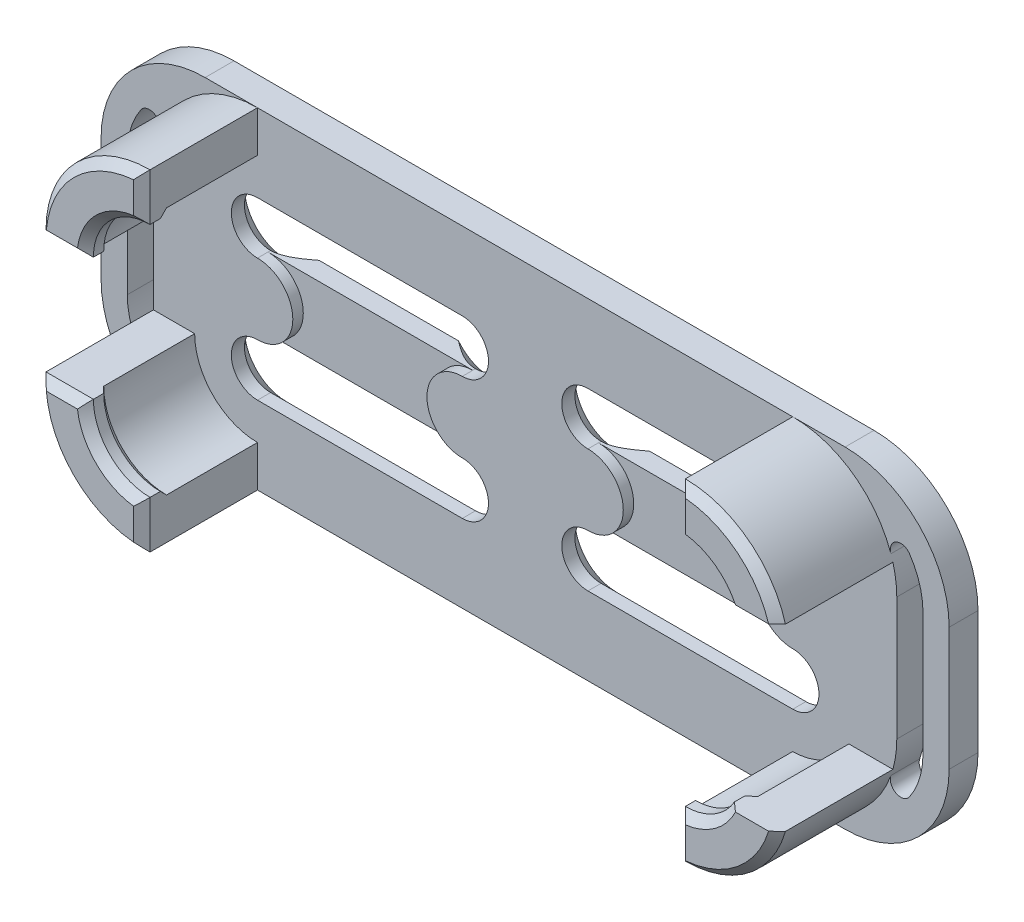
from build123d import *

# Parameters (mm, degrees)
BOSS_EXTRUDE1_DEPTH   = 12.033125032
BOSS_EXTRUDE1_2_DEPTH = 12.033125032
BOSS_EXTRUDE1_3_DEPTH = 12.033125032
BOSS_EXTRUDE1_4_DEPTH = 12.033125032
BOSS_EXTRUDE2_START   = 3.5
BOSS_EXTRUDE2_DEPTH   = 3.5
BOSS_EXTRUDE3_DEPTH   = 2
CUT_EXTRUDE1_DEPTH    = 1.27
CHAMFER1_SIZE         = 1
CUT_EXTRUDE2_DEPTH    = 52.31068182
BOSS_EXTRUDE4_DEPTH   = 3.5
FILLET1_R             = 1.27
CHAMFER2_SIZE         = 1.905


with BuildPart() as part:
    # Sketch2 → Boss-Extrude1 (new body)
    with BuildSketch(Plane.XY):
        with BuildLine():
            Line((-32.464375, 20.08125), (-32.464375, 15.08125))
            ThreePointArc((-32.464375, 15.08125), (-37.852528673, 12.849403673), (-40.084375, 7.46125))
            Line((-40.084375, 7.46125), (-45.084375, 7.46125))
            ThreePointArc((-45.084375, 7.46125), (-41.388062579, 16.384937579), (-32.464375, 20.08125))
        make_face()
    extrude(amount=BOSS_EXTRUDE1_DEPTH)



with BuildPart() as body_2:
    # Sketch2 → Boss-Extrude1 2 (new body)
    with BuildSketch(Plane.XY):
        with BuildLine():
            Line((32.464375, 20.08125), (32.464375, 15.08125))
            ThreePointArc((32.464375, 15.08125), (37.852528673, 12.849403673), (40.084375, 7.46125))
            Line((40.084375, 7.46125), (45.084375, 7.46125))
            ThreePointArc((45.084375, 7.46125), (41.388062579, 16.384937579), (32.464375, 20.08125))
        make_face()
    extrude(amount=BOSS_EXTRUDE1_2_DEPTH)


with BuildPart() as body_3:
    # Sketch2 → Boss-Extrude1 3 (new body)
    with BuildSketch(Plane.XY):
        with BuildLine():
            Line((-40.084375, -7.46125), (-45.084375, -7.46125))
            ThreePointArc((-45.084375, -7.46125), (-41.388062579, -16.384937579), (-32.464375, -20.08125))
            Line((-32.464375, -20.08125), (-32.464375, -15.08125))
            ThreePointArc((-32.464375, -15.08125), (-37.852528673, -12.849403673), (-40.084375, -7.46125))
        make_face()
    extrude(amount=BOSS_EXTRUDE1_3_DEPTH)


with BuildPart() as body_4:
    # Sketch2 → Boss-Extrude1 4 (new body)
    with BuildSketch(Plane.XY):
        with BuildLine():
            Line((32.464375, -20.08125), (32.464375, -15.08125))
            ThreePointArc((32.464375, -15.08125), (37.852528673, -12.849403673), (40.084375, -7.46125))
            Line((40.084375, -7.46125), (45.084375, -7.46125))
            ThreePointArc((45.084375, -7.46125), (41.388062579, -16.384937579), (32.464375, -20.08125))
        make_face()
    extrude(amount=BOSS_EXTRUDE1_4_DEPTH)


with BuildPart() as part_1:
    add(part.part)

    add(body_2.part)  # Boss-Extrude2 merges body 2

    add(body_3.part)  # Boss-Extrude2 merges body 3

    add(body_4.part)  # Boss-Extrude2 merges body 4
    # Sketch3 → Boss-Extrude2 (add)
    with BuildSketch(Plane(origin=(0, 0, 0), x_dir=(-1, 0, 0), z_dir=(0, 0, -1)).offset(BOSS_EXTRUDE2_START)):
        with BuildLine():
            Line((-45.084375, 7.46125), (-45.084375, -7.46125))
            ThreePointArc((-45.084375, -7.46125), (-41.388062579, -16.384937579), (-32.464375, -20.08125))
            Line((-32.464375, -20.08125), (32.464375, -20.08125))
            ThreePointArc((32.464375, -20.08125), (41.388062579, -16.384937579), (45.084375, -7.46125))
            Line((45.084375, -7.46125), (45.084375, 7.46125))
            ThreePointArc((45.084375, 7.46125), (41.388062579, 16.384937579), (32.464375, 20.08125))
            Line((32.464375, 20.08125), (-32.464375, 20.08125))
            ThreePointArc((-32.464375, 20.08125), (-41.388062579, 16.384937579), (-45.084375, 7.46125))
        make_face()
        with BuildLine():
            Line((7.62, 10.63625), (32.464375, 10.63625))
            ThreePointArc((32.464375, 10.63625), (35.639375, 7.46125), (32.464375, 4.28625))
            Line((32.464375, 4.28625), (7.62, 4.28625))
            ThreePointArc((7.62, 4.28625), (4.445, 7.46125), (7.62, 10.63625))
        make_face(mode=Mode.SUBTRACT)
        with BuildLine():
            Line((7.62, -10.63625), (32.464375, -10.63625))
            ThreePointArc((32.464375, -10.63625), (35.639375, -7.46125), (32.464375, -4.28625))
            Line((32.464375, -4.28625), (7.62, -4.28625))
            ThreePointArc((7.62, -4.28625), (4.445, -7.46125), (7.62, -10.63625))
        make_face(mode=Mode.SUBTRACT)
        with BuildLine():
            Line((-7.62, -10.63625), (-32.464375, -10.63625))
            ThreePointArc((-32.464375, -10.63625), (-35.639375, -7.46125), (-32.464375, -4.28625))
            Line((-32.464375, -4.28625), (-7.62, -4.28625))
            ThreePointArc((-7.62, -4.28625), (-4.445, -7.46125), (-7.62, -10.63625))
        make_face(mode=Mode.SUBTRACT)
        with BuildLine():
            Line((-7.62, 10.63625), (-32.464375, 10.63625))
            ThreePointArc((-32.464375, 10.63625), (-35.639375, 7.46125), (-32.464375, 4.28625))
            Line((-32.464375, 4.28625), (-7.62, 4.28625))
            ThreePointArc((-7.62, 4.28625), (-4.445, 7.46125), (-7.62, 10.63625))
        make_face(mode=Mode.SUBTRACT)
    extrude(amount=-BOSS_EXTRUDE2_DEPTH)

    # Sketch5 → Boss-Extrude3 (add)
    with BuildSketch(Plane.XY.offset(12.033125032)):
        with BuildLine():
            Line((-32.464375, 14.33125), (-32.464375, 20.08125))
            ThreePointArc((-32.464375, 20.08125), (-41.388062579, 16.384937579), (-45.084375, 7.46125))
            Line((-45.084375, 7.46125), (-39.334375, 7.46125))
            ThreePointArc((-39.334375, 7.46125), (-37.322198587, 12.319073587), (-32.464375, 14.33125))
        make_face()
        with BuildLine():
            Line((32.464375, 14.33125), (32.464375, 20.08125))
            ThreePointArc((32.464375, 20.08125), (41.388062579, 16.384937579), (45.084375, 7.46125))
            Line((45.084375, 7.46125), (39.334375, 7.46125))
            ThreePointArc((39.334375, 7.46125), (37.322198587, 12.319073587), (32.464375, 14.33125))
        make_face()
        with BuildLine():
            Line((45.084375, -7.46125), (39.334375, -7.46125))
            ThreePointArc((39.334375, -7.46125), (37.322198587, -12.319073587), (32.464375, -14.33125))
            Line((32.464375, -14.33125), (32.464375, -20.08125))
            ThreePointArc((32.464375, -20.08125), (41.388062579, -16.384937579), (45.084375, -7.46125))
        make_face()
        with BuildLine():
            Line((-45.084375, -7.46125), (-39.334375, -7.46125))
            ThreePointArc((-39.334375, -7.46125), (-37.322198587, -12.319073587), (-32.464375, -14.33125))
            Line((-32.464375, -14.33125), (-32.464375, -20.08125))
            ThreePointArc((-32.464375, -20.08125), (-41.388062579, -16.384937579), (-45.084375, -7.46125))
        make_face()
    extrude(amount=BOSS_EXTRUDE3_DEPTH)

    # Sketch4 → Cut-Extrude1 (cut)
    with BuildSketch(Plane.XY):
        with BuildLine():
            Line((-32.464375, -4.28625), (-7.62, -4.28625))
            ThreePointArc((-7.62, -4.28625), (-11.90625, 0), (-7.62, 4.28625))
            Line((-7.62, 4.28625), (-32.464375, 4.28625))
            ThreePointArc((-32.464375, 4.28625), (-28.178125, 0), (-32.464375, -4.28625))
        make_face()
    cut_extrude1 = extrude(amount=-CUT_EXTRUDE1_DEPTH, mode=Mode.SUBTRACT)

    # Chamfer1
    # the kernel refuses this chamfer: 1 mm, written as the material it adds along each edge
    with BuildSketch(Plane(origin=(-32.464375, -7.46125, 12.033125032), x_dir=(0, -1, 0), z_dir=(1, 0, 0))) as chamfer1_piece_1_section:
        Polygon((7.62, CHAMFER1_SIZE), (7.62 - CHAMFER1_SIZE, 0), (7.62, 0), align=None)
    chamfer1_piece_1 = revolve(axis=Axis((-32.464375, -7.46125, 12.033125032), (0, 0, -1)), revolution_arc=90, mode=Mode.PRIVATE)
    chamfer1_piece_1 = chamfer1_piece_1 - Plane(origin=(-32.464375, -7.46125, 11.406730953), x_dir=(-1, 0, 0), z_dir=(0, 0, -1)) * Cylinder(6.87, 31, mode=Mode.PRIVATE)
    add(chamfer1_piece_1)
    with BuildSketch(Plane(origin=(32.464375, -7.46125, 12.033125032), x_dir=(0, -1, 0), z_dir=(-1, 0, 0))) as chamfer1_piece_2_section:
        Polygon((7.62, -CHAMFER1_SIZE), (7.62 - CHAMFER1_SIZE, 0), (7.62, 0), align=None)
    chamfer1_piece_2 = revolve(axis=Axis((32.464375, -7.46125, 12.033125032), (0, 0, 1)), revolution_arc=90, mode=Mode.PRIVATE)
    chamfer1_piece_2 = chamfer1_piece_2 - Plane(origin=(32.464375, -7.46125, 11.406730953), x_dir=(1, 0, 0), z_dir=(0, 0, -1)) * Cylinder(6.87, 31, mode=Mode.PRIVATE)
    add(chamfer1_piece_2)
    with BuildSketch(Plane(origin=(32.464375, 7.46125, 12.033125032), x_dir=(0, 1, 0), z_dir=(-1, 0, 0))) as chamfer1_piece_3_section:
        Polygon((7.62, CHAMFER1_SIZE), (7.62 - CHAMFER1_SIZE, 0), (7.62, 0), align=None)
    chamfer1_piece_3 = revolve(axis=Axis((32.464375, 7.46125, 12.033125032), (0, 0, -1)), revolution_arc=90, mode=Mode.PRIVATE)
    chamfer1_piece_3 = chamfer1_piece_3 - Plane(origin=(32.464375, 7.46125, 11.406730953), x_dir=(1, 0, 0), z_dir=(0, 0, -1)) * Cylinder(6.87, 31, mode=Mode.PRIVATE)
    add(chamfer1_piece_3)
    with BuildSketch(Plane(origin=(-32.464375, 7.46125, 12.033125032), x_dir=(0, 1, 0), z_dir=(1, 0, 0))) as chamfer1_piece_4_section:
        Polygon((7.62 - CHAMFER1_SIZE, 0), (7.62, -CHAMFER1_SIZE), (7.62, 0), align=None)
    chamfer1_piece_4 = revolve(axis=Axis((-32.464375, 7.46125, 12.033125032), (0, 0, 1)), revolution_arc=90, mode=Mode.PRIVATE)
    chamfer1_piece_4 = chamfer1_piece_4 - Plane(origin=(-32.464375, 7.46125, 11.406730953), x_dir=(-1, 0, 0), z_dir=(0, 0, -1)) * Cylinder(6.87, 31, mode=Mode.PRIVATE)
    add(chamfer1_piece_4)
    # the kernel refuses this chamfer: 1 mm, written as the material it takes off along each edge
    with BuildSketch(Plane(origin=(47.656057988, 7.46125, 14.033125032), x_dir=(0, 0.9996219169112968, 0.027495876610585647), z_dir=(-1, 0, 0)), Plane(origin=(32.464375, 11.759567012, 14.033125032), x_dir=(0.9996219169112968, -1.2352592896833197e-15, 0.02749587661058555), z_dir=(0, 1, 0)), Plane(origin=(-32.464375, 11.759567012, 14.033125032), x_dir=(0.0274958766105891, 0, -0.9996219169112968), z_dir=(0, 1, 0)), Plane(origin=(-47.656057988, 7.46125, 14.033125032), x_dir=(0, -0.02749587661058651, -0.9996219169112968), z_dir=(1, 0, 0)), Plane(origin=(-47.656057988, -7.46125, 14.033125032), x_dir=(0, -0.9996219169112968, 0.027495876610585623), z_dir=(1, 0, 0)), Plane(origin=(-32.464375, -11.759567012, 14.033125032), x_dir=(-0.9996219169112968, 1.2352592896833197e-15, 0.02749587661058555), z_dir=(0, -1, 0))) as chamfer1_2_piece_1:
        Polygon((CHAMFER1_SIZE * 0.999621916911, CHAMFER1_SIZE * 0.0274958766106), (-CHAMFER1_SIZE * 0.0274958766106, CHAMFER1_SIZE * 0.999621916911), (0, 0), align=None)
    extrude(amount=10.893365976, mode=Mode.SUBTRACT)
    with BuildSketch(Plane(origin=(32.464375, 7.46125, 14.033125032), x_dir=(0.9306959103421094, -0.36579382508794805, 0), z_dir=(-0.36579382508794805, -0.9306959103421094, 0))) as chamfer1_2_piece_2:
        Polygon((6.87 + CHAMFER1_SIZE, 0), (6.87, -CHAMFER1_SIZE), (6.87, 0), align=None)
    revolve(axis=Axis((32.464375, 7.46125, 14.033125032), (0, 0, 1)), revolution_arc=132.912888437, mode=Mode.SUBTRACT)
    with BuildSketch(Plane(origin=(32.464375, 7.46125, 14.033125032), x_dir=(-0.2024511198117661, 0.9792923690537785, 0), z_dir=(-0.9792923690537785, -0.2024511198117661, 0))) as chamfer1_2_piece_3:
        Polygon((12.62, CHAMFER1_SIZE), (12.62 - CHAMFER1_SIZE, 0), (12.62, 0), align=None)
    revolve(axis=Axis((32.464375, 7.46125, 14.033125032), (0, 0, -1)), revolution_arc=113.360661138, mode=Mode.SUBTRACT)
    with BuildSketch(Plane(origin=(47.656057988, -7.46125, 14.033125032), x_dir=(0, -0.9996219169112968, 0.027495876610585647), z_dir=(-1, 0, 0)), Plane(origin=(32.464375, -11.759567012, 14.033125032), x_dir=(0.9996219169112968, 1.2352592896833197e-15, 0.02749587661058555), z_dir=(0, -1, 0))) as chamfer1_2_piece_4:
        Polygon((CHAMFER1_SIZE * 0.999621916911, -CHAMFER1_SIZE * 0.0274958766106), (-CHAMFER1_SIZE * 0.0274958766106, -CHAMFER1_SIZE * 0.999621916911), (0, 0), align=None)
    extrude(amount=10.893365976, mode=Mode.SUBTRACT)
    with BuildSketch(Plane(origin=(32.464375, -7.46125, 14.033125032), x_dir=(-0.2024511198117661, -0.9792923690537785, 0), z_dir=(-0.9792923690537785, 0.2024511198117661, 0))) as chamfer1_2_piece_5:
        Polygon((12.62, -CHAMFER1_SIZE), (12.62 - CHAMFER1_SIZE, 0), (12.62, 0), align=None)
    revolve(axis=Axis((32.464375, -7.46125, 14.033125032), (0, 0, 1)), revolution_arc=113.360661138, mode=Mode.SUBTRACT)
    with BuildSketch(Plane(origin=(32.464375, -7.46125, 14.033125032), x_dir=(0.9306959103421094, 0.36579382508794805, 0), z_dir=(-0.36579382508794805, 0.9306959103421094, 0))) as chamfer1_2_piece_6:
        Polygon((6.87 + CHAMFER1_SIZE, 0), (6.87, CHAMFER1_SIZE), (6.87, 0), align=None)
    revolve(axis=Axis((32.464375, -7.46125, 14.033125032), (0, 0, -1)), revolution_arc=132.912888437, mode=Mode.SUBTRACT)
    with BuildSketch(Plane(origin=(-32.464375, 7.46125, 14.033125032), x_dir=(-0.9306959103421083, -0.3657938250879505, 0), z_dir=(0.3657938250879505, -0.9306959103421083, 0))) as chamfer1_2_piece_7:
        Polygon((6.87, CHAMFER1_SIZE), (6.87 + CHAMFER1_SIZE, 0), (6.87, 0), align=None)
    revolve(axis=Axis((-32.464375, 7.46125, 14.033125032), (0, 0, -1)), revolution_arc=132.912888437, mode=Mode.SUBTRACT)
    with BuildSketch(Plane(origin=(-32.464375, 7.46125, 14.033125032), x_dir=(0.20245111981176475, 0.9792923690537788, 0), z_dir=(0.9792923690537788, -0.20245111981176475, 0))) as chamfer1_2_piece_8:
        Polygon((12.62 - CHAMFER1_SIZE, 0), (12.62, -CHAMFER1_SIZE), (12.62, 0), align=None)
    revolve(axis=Axis((-32.464375, 7.46125, 14.033125032), (0, 0, 1)), revolution_arc=113.360661138, mode=Mode.SUBTRACT)
    with BuildSketch(Plane(origin=(-32.464375, -7.46125, 14.033125032), x_dir=(-0.9306959103421094, 0.3657938250879479, 0), z_dir=(0.3657938250879479, 0.9306959103421094, 0))) as chamfer1_2_piece_9:
        Polygon((6.87 + CHAMFER1_SIZE, 0), (6.87, -CHAMFER1_SIZE), (6.87, 0), align=None)
    revolve(axis=Axis((-32.464375, -7.46125, 14.033125032), (0, 0, 1)), revolution_arc=132.912888437, mode=Mode.SUBTRACT)
    with BuildSketch(Plane(origin=(-32.464375, -7.46125, 14.033125032), x_dir=(0.20245111981176475, -0.9792923690537788, 0), z_dir=(0.9792923690537788, 0.20245111981176475, 0))) as chamfer1_2_piece_10:
        Polygon((12.62, CHAMFER1_SIZE), (12.62 - CHAMFER1_SIZE, 0), (12.62, 0), align=None)
    revolve(axis=Axis((-32.464375, -7.46125, 14.033125032), (0, 0, -1)), revolution_arc=113.360661138, mode=Mode.SUBTRACT)

    # Sketch7 → Cut-Extrude2 (cut, through all)
    with BuildSketch(Plane.XY):
        with BuildLine():
            ThreePointArc((40.084375, -7.46125), (39.878618249, -9.220055574), (39.272459764, -10.883877915))
            Line((39.272459764, -10.883877915), (44.611391842, -10.883877915))
            ThreePointArc((44.611391842, -10.883877915), (44.965569994, -9.188827416), (45.084375, -7.46125))
            Line((45.084375, -7.46125), (40.084375, -7.46125))
        make_face()
        with BuildLine():
            ThreePointArc((45.084375, 7.46125), (44.965569994, 9.188827416), (44.611391842, 10.883877915))
            Line((44.611391842, 10.883877915), (39.272459764, 10.883877915))
            ThreePointArc((39.272459764, 10.883877915), (39.878618249, 9.220055574), (40.084375, 7.46125))
            Line((40.084375, 7.46125), (45.084375, 7.46125))
        make_face()
        with BuildLine():
            ThreePointArc((40.084375, 7.46125), (39.878618249, 9.220055574), (39.272459764, 10.883877915))
            Line((39.272459764, 10.883877915), (38.42109542, 10.883877915))
            ThreePointArc((38.42109542, 10.883877915), (39.102129488, 9.232440379), (39.334375, 7.46125))
            Line((39.334375, 7.46125), (40.084375, 7.46125))
        make_face()
        with BuildLine():
            ThreePointArc((39.334375, -7.46125), (39.102129488, -9.232440379), (38.42109542, -10.883877915))
            Line((38.42109542, -10.883877915), (39.272459764, -10.883877915))
            ThreePointArc((39.272459764, -10.883877915), (39.878618249, -9.220055574), (40.084375, -7.46125))
            Line((40.084375, -7.46125), (39.334375, -7.46125))
        make_face()
    extrude(amount=CUT_EXTRUDE2_DEPTH, mode=Mode.SUBTRACT)

    # Sketch8 → Boss-Extrude4 (add)
    with BuildSketch(Plane(origin=(0, 0, -3.5), x_dir=(-1, 0, 0), z_dir=(0, 0, -1))):
        with BuildLine():
            ThreePointArc((-38.814375, 20.08125), (-47.738062579, 16.384937579), (-51.434375, 7.46125))
            Line((-51.434375, 7.46125), (-51.434375, -7.46125))
            ThreePointArc((-51.434375, -7.46125), (-47.738062579, -16.384937579), (-38.814375, -20.08125))
            Line((-38.814375, -20.08125), (-32.464375, -20.08125))
            ThreePointArc((-32.464375, -20.08125), (-37.14350905, -19.18174933), (-41.155625, -16.61147259))
            ThreePointArc((-41.155625, -16.61147259), (-46.274975889, -13.253266866), (-48.259375, -7.46125))
            Line((-48.259375, -7.46125), (-48.259375, 7.46125))
            ThreePointArc((-48.259375, 7.46125), (-46.274975889, 13.253266866), (-41.155625, 16.61147259))
            ThreePointArc((-41.155625, 16.61147259), (-37.14350905, 19.18174933), (-32.464375, 20.08125))
            Line((-32.464375, 20.08125), (-38.814375, 20.08125))
        make_face()
        with BuildLine():
            ThreePointArc((48.259375, -7.46125), (46.274975889, -13.253266866), (41.155625, -16.61147259))
            ThreePointArc((41.155625, -16.61147259), (37.14350905, -19.18174933), (32.464375, -20.08125))
            Line((32.464375, -20.08125), (38.814375, -20.08125))
            ThreePointArc((38.814375, -20.08125), (47.738062579, -16.384937579), (51.434375, -7.46125))
            Line((51.434375, -7.46125), (51.434375, 7.46125))
            ThreePointArc((51.434375, 7.46125), (47.738062579, 16.384937579), (38.814375, 20.08125))
            Line((38.814375, 20.08125), (32.464375, 20.08125))
            ThreePointArc((32.464375, 20.08125), (37.14350905, 19.18174933), (41.155625, 16.61147259))
            ThreePointArc((41.155625, 16.61147259), (46.274975889, 13.253266866), (48.259375, 7.46125))
            Line((48.259375, 7.46125), (48.259375, -7.46125))
        make_face()
    extrude(amount=-BOSS_EXTRUDE4_DEPTH)

    # Fillet1
    fillet1_edges = [part_1.edges().sort_by_distance(p)[0] for p in [
        (41.155625, -16.61147259, -1.75),
        (41.155625, 16.61147259, -1.75),
        (-41.155625, -16.61147259, -1.75),
        (-41.155625, 16.61147259, -1.75),
    ]]
    fillet(fillet1_edges, radius=FILLET1_R)

    # Mirror3: Cut-Extrude1 across plane
    add(cut_extrude1.mirror(Plane(origin=(0, 0, 0), x_dir=(0, 0, 1), z_dir=(1, 0, 0))), mode=Mode.SUBTRACT)

    # Chamfer2
    # the kernel refuses this chamfer: 1.905 mm, written as the material it takes off along each edge
    with BuildSketch(Plane(origin=(-7.62, 7.46125, -3.5), x_dir=(-0.999679843484402, -0.025302381923478088, 0), z_dir=(-0.025302381923478088, 0.999679843484402, 0))) as chamfer2_piece_1:
        Polygon((3.175 + CHAMFER2_SIZE, 0), (3.175, CHAMFER2_SIZE), (3.175, 0), align=None)
    revolve(axis=Axis((-7.62, 7.46125, -3.5), (0, 0, 1)), revolution_arc=268.550125572, mode=Mode.SUBTRACT)
    with BuildSketch(Plane(origin=(-32.464375, 7.46125, -3.5), x_dir=(0, 1, 0), z_dir=(1, 0, 0))) as chamfer2_piece_2:
        Polygon((3.175 + CHAMFER2_SIZE, 0), (3.175, CHAMFER2_SIZE), (3.175, 0), align=None)
    revolve(axis=Axis((-32.464375, 7.46125, -3.5), (0, 0, 1)), revolution_arc=268.550125572, mode=Mode.SUBTRACT)
    with BuildSketch(Plane(origin=(-7.62, 10.63625, -3.5), x_dir=(0, 0.9996219169112968, -0.027495876610586386), z_dir=(-1, 0, 0)), Plane(origin=(7.62, -10.63625, -3.5), x_dir=(0, -0.9996219169112968, -0.027495876610586386), z_dir=(1, 0, 0))) as chamfer2_piece_3:
        Polygon((CHAMFER2_SIZE * 0.999621916911, -CHAMFER2_SIZE * 0.0274958766106), (-CHAMFER2_SIZE * 0.0274958766106, -CHAMFER2_SIZE * 0.999621916911), (0, 0), align=None)
    extrude(amount=24.844375, mode=Mode.SUBTRACT)
    with BuildSketch(Plane(origin=(-7.62, -7.46125, -3.5), x_dir=(-0.9996798434844021, 0.02530238192347752, 0), z_dir=(-0.02530238192347752, -0.9996798434844021, 0))) as chamfer2_piece_4:
        Polygon((3.175 + CHAMFER2_SIZE, 0), (3.175, -CHAMFER2_SIZE), (3.175, 0), align=None)
    revolve(axis=Axis((-7.62, -7.46125, -3.5), (0, 0, -1)), revolution_arc=268.550125572, mode=Mode.SUBTRACT)
    with BuildSketch(Plane(origin=(-7.62, -10.63625, -3.5), x_dir=(0, -0.9996219169112968, -0.027495876610586386), z_dir=(-1, 0, 0)), Plane(origin=(7.62, 10.63625, -3.5), x_dir=(0, 0.9996219169112968, -0.027495876610586386), z_dir=(1, 0, 0))) as chamfer2_piece_5:
        Polygon((CHAMFER2_SIZE * 0.999621916911, CHAMFER2_SIZE * 0.0274958766106), (-CHAMFER2_SIZE * 0.0274958766106, CHAMFER2_SIZE * 0.999621916911), (0, 0), align=None)
    extrude(amount=24.844375, mode=Mode.SUBTRACT)
    with BuildSketch(Plane(origin=(-32.464375, -7.46125, -3.5), x_dir=(0, -1, 0), z_dir=(1, 0, 0))) as chamfer2_piece_6:
        Polygon((3.175 + CHAMFER2_SIZE, 0), (3.175, -CHAMFER2_SIZE), (3.175, 0), align=None)
    revolve(axis=Axis((-32.464375, -7.46125, -3.5), (0, 0, -1)), revolution_arc=268.550125572, mode=Mode.SUBTRACT)
    with BuildSketch(Plane(origin=(7.62, -7.46125, -3.5), x_dir=(0.9996798434844021, 0.02530238192347752, 0), z_dir=(0.02530238192347752, -0.9996798434844021, 0))) as chamfer2_piece_7:
        Polygon((3.175 + CHAMFER2_SIZE, 0), (3.175, CHAMFER2_SIZE), (3.175, 0), align=None)
    revolve(axis=Axis((7.62, -7.46125, -3.5), (0, 0, 1)), revolution_arc=268.550125572, mode=Mode.SUBTRACT)
    with BuildSketch(Plane(origin=(32.464375, -7.46125, -3.5), x_dir=(0, -1, 0), z_dir=(-1, 0, 0))) as chamfer2_piece_8:
        Polygon((3.175 + CHAMFER2_SIZE, 0), (3.175, CHAMFER2_SIZE), (3.175, 0), align=None)
    revolve(axis=Axis((32.464375, -7.46125, -3.5), (0, 0, 1)), revolution_arc=268.550125572, mode=Mode.SUBTRACT)
    with BuildSketch(Plane(origin=(7.62, 7.46125, -3.5), x_dir=(0.999679843484402, -0.025302381923478088, 0), z_dir=(0.025302381923478088, 0.999679843484402, 0))) as chamfer2_piece_9:
        Polygon((3.175 + CHAMFER2_SIZE, 0), (3.175, -CHAMFER2_SIZE), (3.175, 0), align=None)
    revolve(axis=Axis((7.62, 7.46125, -3.5), (0, 0, -1)), revolution_arc=268.550125572, mode=Mode.SUBTRACT)
    with BuildSketch(Plane(origin=(32.464375, 7.46125, -3.5), x_dir=(0, 1, 0), z_dir=(-1, 0, 0))) as chamfer2_piece_10:
        Polygon((3.175 + CHAMFER2_SIZE, 0), (3.175, -CHAMFER2_SIZE), (3.175, 0), align=None)
    revolve(axis=Axis((32.464375, 7.46125, -3.5), (0, 0, -1)), revolution_arc=268.550125572, mode=Mode.SUBTRACT)


solid = part_1.part
